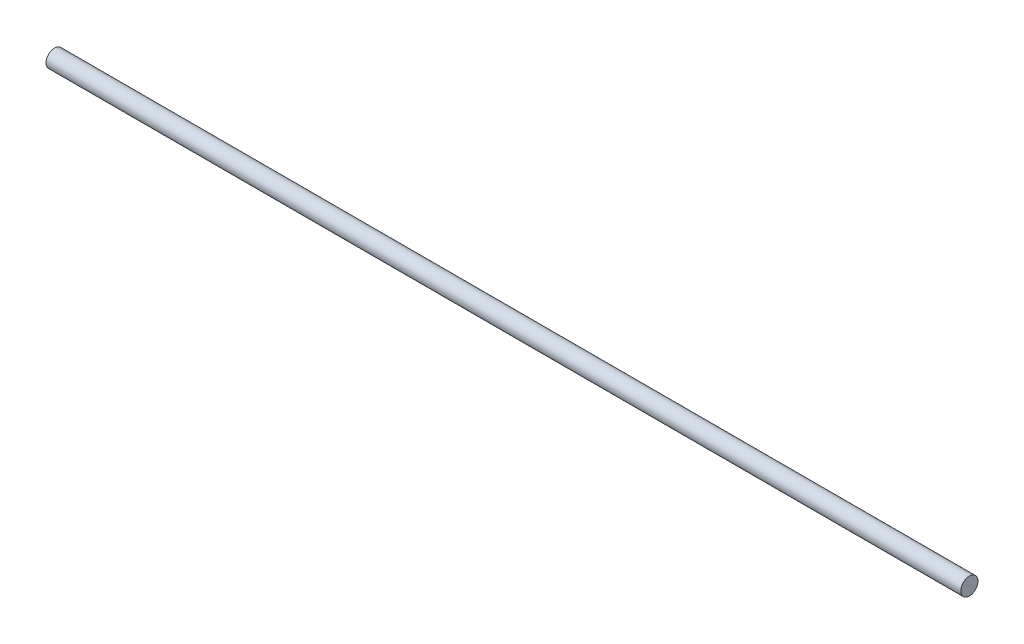
from build123d import *

# Parameters (mm, degrees)
SKETCH1_R           = 3.81
BOSS_EXTRUDE1_DEPTH = 403.969545343


with BuildPart() as part:
    # Sketch1 → Boss-Extrude1 (new body)
    with BuildSketch(Plane(origin=(0, 0, 0), x_dir=(0, 0, -1), z_dir=(1, 0, 0))):
        Circle(SKETCH1_R)
    extrude(amount=BOSS_EXTRUDE1_DEPTH)


solid = part.part
